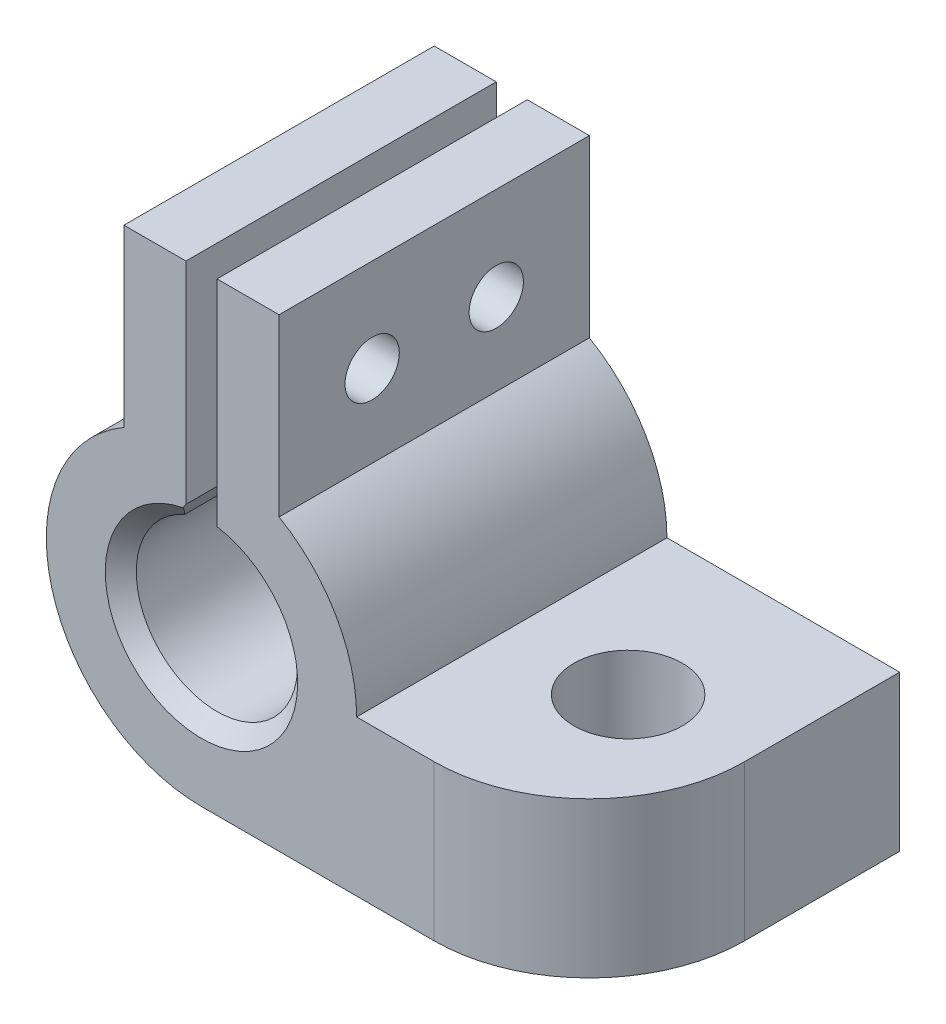
from build123d import *

# Parameters (mm, degrees)
DODANIE_WYCI_GNI_CIE1_DEPTH = 20
SFAZOWANIE1_SIZE            = 1.267383774
SFAZOWANIE1_SIZE_2          = 1
SZKIC2_R                    = 1.75
WYTNIJ_WYCI_GNI_CIE1_DEPTH  = 10
WYTNIJ_WYCI_GNI_CIE2_START  = -1
SZKIC3_R                    = 1.75
WYTNIJ_WYCI_GNI_CIE2_DEPTH  = 1
DODANIE_WYCI_GNI_CIE2_START = -20
DODANIE_WYCI_GNI_CIE2_DEPTH = 20
SZKIC5_R                    = 3.5
WYTNIJ_WYCI_GNI_CIE3_DEPTH  = 20
ZAOKR_GLENIE1_R             = 10


with BuildPart() as part:
    # Szkic1 → Dodanie-wyciągnięcie1 (new body)
    with BuildSketch(Plane.XY):
        with BuildLine():
            ThreePointArc((5.2, 0), (-3.304542328, -4.01497198), (-1, 5.102940329))
            Line((-1, 5.102940329), (-1, 9.949874371))
            ThreePointArc((-1, 9.949874371), (-3.068514323, 9.517574263), (-5, 8.660254038))
            ThreePointArc((-5, 8.660254038), (-5, -8.660254038), (10, 0))
            ThreePointArc((10, 0), (8.660254038, 5), (5, 8.660254038))
            ThreePointArc((5, 8.660254038), (3.068514323, 9.517574263), (1, 9.949874371))
            Line((1, 9.949874371), (1, 5.102940329))
            ThreePointArc((1, 5.102940329), (4.01497198, 3.304542328), (5.2, 0))
        make_face()
        with BuildLine():
            ThreePointArc((-5, 8.660254038), (-3.068514323, 9.517574263), (-1, 9.949874371))
            Line((-1, 9.949874371), (-1, 19.949874371))
            Line((-1, 19.949874371), (-5, 19.949874371))
            Line((-5, 19.949874371), (-5, 8.660254038))
        make_face()
        with BuildLine():
            Line((1, 19.949874371), (1, 9.949874371))
            ThreePointArc((1, 9.949874371), (3.068514323, 9.517574263), (5, 8.660254038))
            Line((5, 8.660254038), (5, 19.949874371))
            Line((5, 19.949874371), (1, 19.949874371))
        make_face()
    extrude(amount=DODANIE_WYCI_GNI_CIE1_DEPTH)

    # Sfazowanie1
    # the kernel refuses this chamfer: 1.267383774, 1 mm, written as the material it takes off along each edge
    with BuildSketch(Plane(origin=(-1, 5.102940329, -3.274401996), x_dir=(0, 1, 0), z_dir=(0, 0, 1))) as sfazowanie1_piece_1:
        with BuildLine():
            Line((SFAZOWANIE1_SIZE, 0), (-0.336229117, 1.078091485))
            ThreePointArc((-0.336229117, 1.078091485), (-0.144735056, 0.567227001), (0, 0))
            Line((0, 0), (SFAZOWANIE1_SIZE, 0))
        make_face()
    extrude(amount=26.548803992, mode=Mode.SUBTRACT)
    with BuildSketch(Plane(origin=(1, 5.102940329, -4.38469538), x_dir=(0.9364406344520153, -0.35082607962793627, 0), z_dir=(0, 0, 1))) as sfazowanie1_piece_2:
        with BuildLine():
            Line((1.707607831, 0), (-SFAZOWANIE1_SIZE_2 * 0.350826079628, SFAZOWANIE1_SIZE_2 * 0.936440634452))
            Line((-SFAZOWANIE1_SIZE_2 * 0.350826079628, SFAZOWANIE1_SIZE_2 * 0.936440634452), (0, 0))
            ThreePointArc((0, 0), (0.877241421, 0.070520422), (1.707607831, 0))
        make_face()
    extrude(amount=28.76939076, mode=Mode.SUBTRACT)
    # the kernel refuses this chamfer: 1.267383774, 1 mm, written as the material it takes off along each edge
    with BuildSketch(Plane(origin=(0, 0, 20), x_dir=(0.05297189927018693, 0.9985960033405447, 0), z_dir=(0.9985960033405447, -0.05297189927018693, 0))) as sfazowanie1_2_piece_1:
        Polygon((5.2 + SFAZOWANIE1_SIZE_2, 0), (5.2, -SFAZOWANIE1_SIZE_2), (5.2, 0), align=None)
    revolve(axis=Axis((0, 0, 20), (0, 0, 1)), revolution_arc=359.64, mode=Mode.SUBTRACT)

    # Szkic2 → Wytnij-wyciągnięcie1 (cut)
    with BuildSketch(Plane(origin=(5, 0, 0), x_dir=(0, 0, -1), z_dir=(1, 0, 0))):
        with Locations((-14, 13.949874371)):
            Circle(SZKIC2_R)
        with Locations((-6, 13.949874371)):
            Circle(SZKIC2_R)
    extrude(amount=-WYTNIJ_WYCI_GNI_CIE1_DEPTH, mode=Mode.SUBTRACT)

    # Szkic3 → Wytnij-wyciągnięcie2 (cut)
    # profile 1 of 2: a face of its own
    with BuildSketch(Plane.ZY.offset(5).offset(WYTNIJ_WYCI_GNI_CIE2_START)):
        Polygon((9.464101615, 13.949874371), (7.732050808, 16.949874371), (4.267949192, 16.949874371), (2.535898385, 13.949874371), (4.267949192, 10.949874371), (7.732050808, 10.949874371), align=None)
        with Locations(Location((6, 13.949874371, 0), (0, 0, 270))):
            Circle(SZKIC3_R, mode=Mode.SUBTRACT)
    # profile 2 of 2: a face of its own
    with BuildSketch(Plane.ZY.offset(5).offset(WYTNIJ_WYCI_GNI_CIE2_START)):
        Polygon((10.535898385, 13.949874371), (12.267949192, 10.949874371), (15.732050808, 10.949874371), (17.464101615, 13.949874371), (15.732050808, 16.949874371), (12.267949192, 16.949874371), align=None)
        with Locations(Location((14, 13.949874371, 0), (0, 0, 270))):
            Circle(SZKIC3_R, mode=Mode.SUBTRACT)
    extrude(amount=WYTNIJ_WYCI_GNI_CIE2_DEPTH, mode=Mode.SUBTRACT)

    # Szkic4 → Dodanie-wyciągnięcie2 (add)
    with BuildSketch(Plane.XY.offset(20).offset(DODANIE_WYCI_GNI_CIE2_START)):
        with BuildLine():
            ThreePointArc((10, 0), (7.071067812, -7.071067812), (0, -10))
            Line((0, -10), (25, -10))
            Line((25, -10), (25, 0))
            Line((25, 0), (10, 0))
        make_face()
    extrude(amount=DODANIE_WYCI_GNI_CIE2_DEPTH)

    # Szkic5 → Wytnij-wyciągnięcie3 (cut)
    with BuildSketch(Plane(origin=(0, 0, 0), x_dir=(1, 0, 0), z_dir=(0, 1, 0))):
        with Locations(Location((17.5, -10, 0), (0, 0, 270))):
            Circle(SZKIC5_R)
    extrude(amount=-WYTNIJ_WYCI_GNI_CIE3_DEPTH, mode=Mode.SUBTRACT)

    # Zaokrąglenie1
    zaokr_glenie1_edges = [part.edges().sort_by_distance(p)[0] for p in [
        (25, -5, 20),
    ]]
    fillet(zaokr_glenie1_edges, radius=ZAOKR_GLENIE1_R)


solid = part.part
